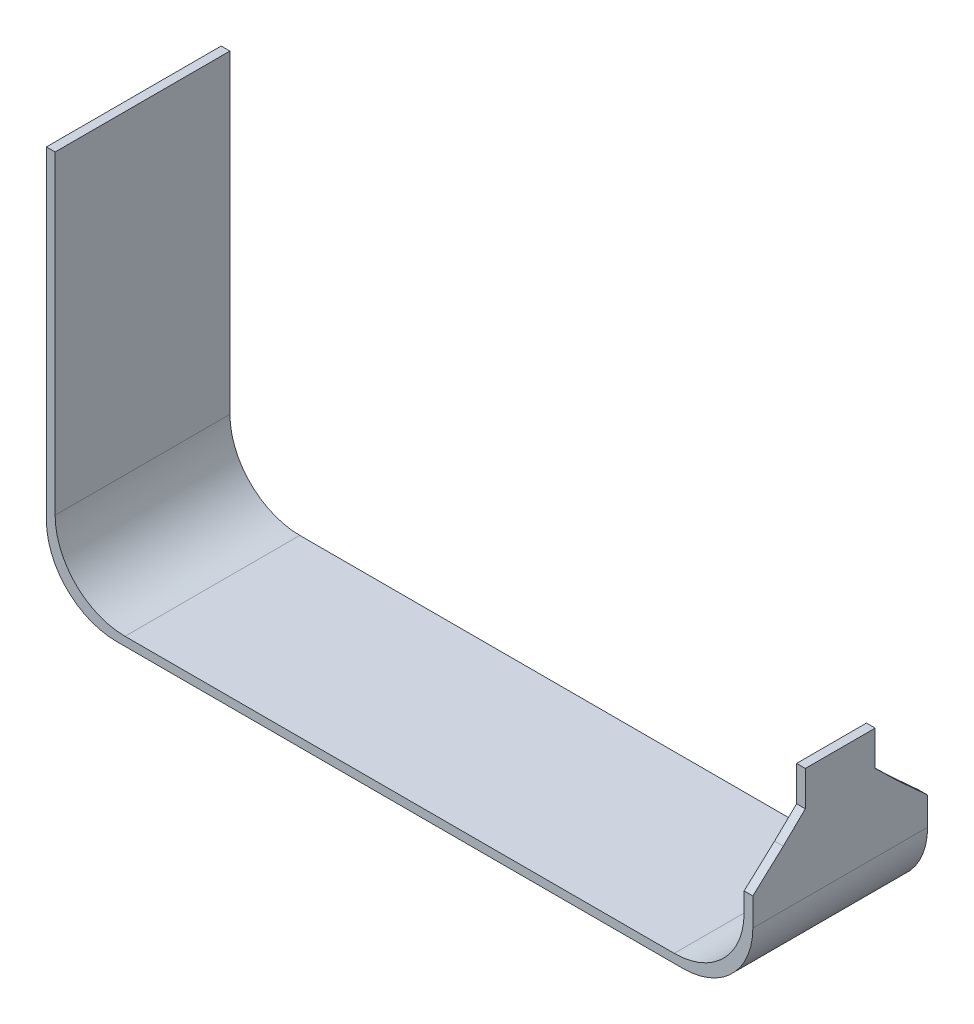
from build123d import *

# Parameters (mm, degrees)
SKETCH1_W           = 28.6
SKETCH1_H           = 5
BOSS_EXTRUDE1_DEPTH = 0.25
SKETCH2_W           = 5
SKETCH2_H           = 11
BOSS_EXTRUDE2_DEPTH = 0.25
BOSS_EXTRUDE3_DEPTH = 0.25
FILLET3_R           = 2
FILLET4_R           = 2
SKETCH4_W           = 6.639451807
SKETCH4_H           = 5
CUT_EXTRUDE1_DEPTH  = 1.5
SKETCH5_W           = 5
SKETCH5_H           = 3.595357205
BOSS_EXTRUDE4_DEPTH = 0.25
FILLET5_R           = 2
FILLET6_R           = 2
BOSS_EXTRUDE5_DEPTH = 0.25
CUT_EXTRUDE2_DEPTH  = 0.25
SKETCH8_W           = 6.875858175
SKETCH8_H           = 9.336027613
CUT_EXTRUDE3_DEPTH  = 5.25


with BuildPart() as part:
    # Sketch1 → Boss-Extrude1 (new body)
    with BuildSketch(Plane(origin=(0, 0, 0), x_dir=(1, 0, 0), z_dir=(0, 1, 0))):
        with Locations((-2.737209302, 3.434883721)):
            Rectangle(SKETCH1_W, SKETCH1_H)
    extrude(amount=BOSS_EXTRUDE1_DEPTH)

    # Sketch2 → Boss-Extrude2 (add)
    with BuildSketch(Plane.ZY.offset(17.037209302)):
        with Locations((-3.434883721, 5.75)):
            Rectangle(SKETCH2_W, SKETCH2_H)
    extrude(amount=-BOSS_EXTRUDE2_DEPTH)

    # Sketch3 → Boss-Extrude3 (add)
    with BuildSketch(Plane(origin=(11.562790698, 0, 0), x_dir=(0, 0, -1), z_dir=(1, 0, 0))):
        Polygon((0.934883721, 0.25), (5.936255285, 0.25), (5.936255285, 2.75), (4.435569503, 4.205909665), (4.435569503, 5.205909665), (3.435569503, 5.205909665), (2.435569503, 5.205909665), (2.435569503, 4.205909665), (0.934883721, 2.75), align=None)
    extrude(amount=-BOSS_EXTRUDE3_DEPTH)

    # Fillet3
    fillet3_edges = [part.edges().sort_by_distance(p)[0] for p in [
        (-16.787209302, 0.25, -3.434883721),
        (11.312790698, 0.25, -3.434883721),
    ]]
    fillet(fillet3_edges, radius=FILLET3_R)

    # Fillet4
    # the kernel refuses this fillet: 2 mm, written as the material it takes off along each edge
    with BuildSketch(Plane(origin=(11.562790698, 0, -10.934883721), x_dir=(-1, 0, 0), z_dir=(0, 0, 1))) as fillet4_piece_1:
        with BuildLine():
            CenterArc((FILLET4_R, -FILLET4_R), FILLET4_R, 90, 90)
            Line((0, -FILLET4_R), (0, 0))
            Line((0, 0), (FILLET4_R, 0))
        make_face()
    extrude(amount=15, mode=Mode.SUBTRACT)
    with BuildSketch(Plane(origin=(-17.037209302, 0, 4.065116279), x_dir=(0, 1, 0), z_dir=(0, 0, -1))) as fillet4_piece_2:
        with BuildLine():
            CenterArc((FILLET4_R, FILLET4_R), FILLET4_R, 180, 90)
            Line((0, FILLET4_R), (0, 0))
            Line((0, 0), (FILLET4_R, 0))
        make_face()
    extrude(amount=15, mode=Mode.SUBTRACT)

    # Sketch4 → Cut-Extrude1 (cut)
    with BuildSketch(Plane.XZ):
        with Locations((6.243064795, -3.434883721)):
            Rectangle(SKETCH4_W, SKETCH4_H)
    extrude(amount=-CUT_EXTRUDE1_DEPTH, mode=Mode.SUBTRACT)


with BuildPart() as cut_extrude1_piece_1:
    # of the separate pieces the step leaves, piece 1, a body of its own (cut_extrude1_pieces)
    add(part.part.solids().sort_by_distance((-16.787209302, 2.25, -5.934883721))[0])

    # Sketch5 → Boss-Extrude4 (add)
    with BuildSketch(Plane(origin=(2.923338891, 0, 0), x_dir=(0, 0, -1), z_dir=(1, 0, 0))):
        with Locations((3.434883721, 1.797678603)):
            Rectangle(SKETCH5_W, SKETCH5_H)
    extrude(amount=BOSS_EXTRUDE4_DEPTH)

    # Fillet5
    fillet5_edges = [cut_extrude1_piece_1.edges().sort_by_distance(p)[0] for p in [
        (2.923338891, 0.25, -3.434883721),
    ]]
    fillet(fillet5_edges, radius=FILLET5_R)

    # Fillet6
    fillet6_edges = [cut_extrude1_piece_1.edges().sort_by_distance(p)[0] for p in [
        (3.173338891, 0, -3.434883721),
    ]]
    fillet(fillet6_edges, radius=FILLET6_R)

    # Sketch6 → Boss-Extrude5 (add)
    with BuildSketch(Plane(origin=(3.173338891, 0, 0), x_dir=(0, 0, -1), z_dir=(1, 0, 0))):
        Polygon((0.934883721, 2.75), (2.435569503, 4.205909665), (2.435569503, 5.205909665), (4.435569503, 5.205909665), (4.435569503, 4.205909665), (5.934883721, 2.75), align=None)
    extrude(amount=-BOSS_EXTRUDE5_DEPTH)

    # Sketch7 → Cut-Extrude2 (cut)
    with BuildSketch(Plane(origin=(3.173338891, 0, 0), x_dir=(0, 0, -1), z_dir=(1, 0, 0))):
        Polygon((1.806239664, 3.595357205), (0.934883721, 3.595357205), (0.934883721, 2.797678603), align=None)
        Polygon((5.064324161, 3.595357205), (5.934883721, 3.595357205), (5.934883721, 2.797678603), align=None)
    extrude(amount=-CUT_EXTRUDE2_DEPTH, mode=Mode.SUBTRACT)


with BuildPart() as cut_extrude1_piece_2:
    # of the separate pieces the step leaves, piece 2, a body of its own (cut_extrude1_pieces)
    add(part.part.solids().sort_by_distance((9.562790698, 0, -5.934883721))[0])

    # Sketch8 → Cut-Extrude3 (cut)
    with BuildSketch(Plane(origin=(0, 0, -5.936255285), x_dir=(-1, 0, 0), z_dir=(0, 0, -1))):
        with Locations((-11.197633492, 2.582921844)):
            Rectangle(SKETCH8_W, SKETCH8_H)
    extrude(amount=-CUT_EXTRUDE3_DEPTH, mode=Mode.SUBTRACT)


solid = cut_extrude1_piece_1.part
